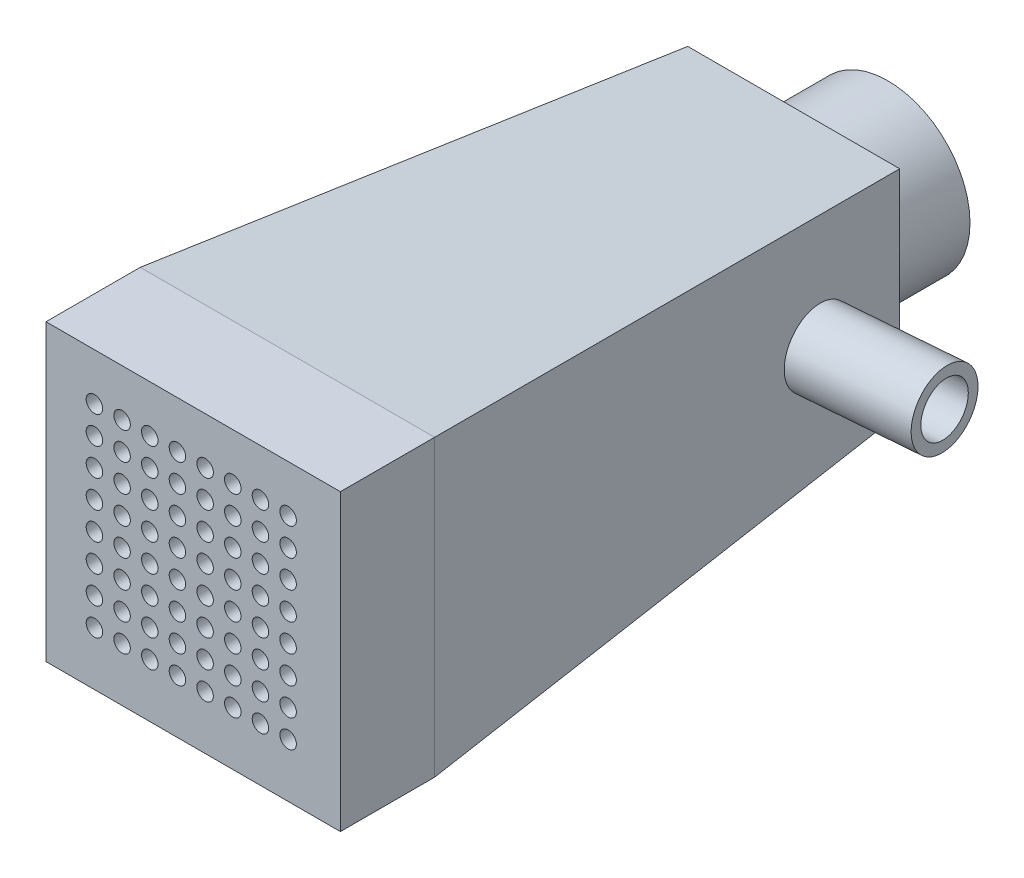
from build123d import *

# Parameters (mm, degrees)
SKETCH2_4_W         = 25
SKETCH2_4_H         = 25
BOSS_EXTRUDE2_DEPTH = 8
SKETCH5_R           = 0.7
CUT_EXTRUDE1_DEPTH  = 8
SKETCH6_R           = 3.1
SKETCH6_R_2         = 2.3
BOSS_EXTRUDE4_DEPTH = 10
CUT_EXTRUDE2_START  = -4
SKETCH6_4_R         = 2.3
CUT_EXTRUDE2_DEPTH  = 4
SKETCH9_R           = 3.1
SKETCH9_R_2         = 2.2
BOSS_EXTRUDE5_DEPTH = 10
SKETCH1_7_R         = 6.969369829
SKETCH1_7_R_2       = 4.88
BOSS_EXTRUDE7_DEPTH = 8


with BuildPart() as part:
    # Sketch1 → Loft1 section 0
    with BuildSketch(Plane.XY):
        with BuildLine():
            Line((-9, 9), (9, 9))
            Line((9, 9), (9, -9))
            Line((9, -9), (-9, -9))
            Line((-9, -9), (-9, 9))
        make_face()
    # Sketch2 → Loft1 section 1
    with BuildSketch(Plane.XY.offset(43)):
        with BuildLine():
            Line((-12.5, 12.5), (12.5, 12.5))
            Line((12.5, 12.5), (12.5, -12.5))
            Line((12.5, -12.5), (-12.5, -12.5))
            Line((-12.5, -12.5), (-12.5, 12.5))
        make_face()
    loft()

    # Cut-Loft1: read off the stored shape, not the designer's step
    # Cut-Loft1: loft between two sections, ruled curve by curve
    cut_loft1_from = [
        Edge.make_bspline([(-3.450681092, -3.450681092, 0), (-3.044014426, -3.857347759, 0), (-2.531155679, -4.22197395, 0), (-1.641760344, -4.606883572, 0), (-1.326204919, -4.708150629, 0), (-0.673711552, -4.84475124, 0), (-0.336893697, -4.88, 0), (0.336893697, -4.88, 0), (0.673711552, -4.84475124, 0), (1.326204919, -4.708150629, 0), (1.641760344, -4.606883572, 0), (2.531155679, -4.22197395, 0), (3.044014426, -3.857347759, 0), (3.450681092, -3.450681092, 0)], [0, 0, 0, 0, 0.25, 0.25, 0.375, 0.375, 0.5, 0.5, 0.625, 0.625, 0.75, 0.75, 1, 1, 1, 1], 3),
        Edge.make_bspline([(3.450681092, -3.450681092, 0), (3.857347759, -3.044014426, 0), (4.22197395, -2.531155679, 0), (4.606883572, -1.641760344, 0), (4.708150629, -1.326204919, 0), (4.84475124, -0.673711552, 0), (4.88, -0.336893697, 0), (4.88, 0.336893697, 0), (4.84475124, 0.673711552, 0), (4.708150629, 1.326204919, 0), (4.606883572, 1.641760344, 0), (4.22197395, 2.531155679, 0), (3.857347759, 3.044014426, 0), (3.450681092, 3.450681092, 0)], [0, 0, 0, 0, 0.25, 0.25, 0.375, 0.375, 0.5, 0.5, 0.625, 0.625, 0.75, 0.75, 1, 1, 1, 1], 3),
        Edge.make_bspline([(-3.450681092, 3.450681092, 0), (-3.857347759, 3.044014426, 0), (-4.22197395, 2.531155679, 0), (-4.606883572, 1.641760344, 0), (-4.708150629, 1.326204919, 0), (-4.84475124, 0.673711552, 0), (-4.88, 0.336893697, 0), (-4.88, -0.336893697, 0), (-4.84475124, -0.673711552, 0), (-4.708150629, -1.326204919, 0), (-4.606883572, -1.641760344, 0), (-4.22197395, -2.531155679, 0), (-3.857347759, -3.044014426, 0), (-3.450681092, -3.450681092, 0)], [0, 0, 0, 0, 0.25, 0.25, 0.375, 0.375, 0.5, 0.5, 0.625, 0.625, 0.75, 0.75, 1, 1, 1, 1], 3),
        Edge.make_bspline([(3.450681092, 3.450681092, 0), (3.044014426, 3.857347759, 0), (2.531155679, 4.22197395, 0), (1.641760344, 4.606883572, 0), (1.326204919, 4.708150629, 0), (0.673711552, 4.84475124, 0), (0.336893697, 4.88, 0), (-0.336893697, 4.88, 0), (-0.673711552, 4.84475124, 0), (-1.326204919, 4.708150629, 0), (-1.641760344, 4.606883572, 0), (-2.531155679, 4.22197395, 0), (-3.044014426, 3.857347759, 0), (-3.450681092, 3.450681092, 0)], [0, 0, 0, 0, 0.25, 0.25, 0.375, 0.375, 0.5, 0.5, 0.625, 0.625, 0.75, 0.75, 1, 1, 1, 1], 3),
    ]
    cut_loft1_to = [
        Edge.make_bspline([(-10, -10, 43), (-8.333333333, -10, 43), (-6.666666667, -10, 43), (-4.166666667, -10, 43), (-3.333333333, -10, 43), (-1.666666667, -10, 43), (-0.833333333, -10, 43), (0.833333333, -10, 43), (1.666666667, -10, 43), (3.333333333, -10, 43), (4.166666667, -10, 43), (6.666666667, -10, 43), (8.333333333, -10, 43), (10, -10, 43)], [0, 0, 0, 0, 0.25, 0.25, 0.375, 0.375, 0.5, 0.5, 0.625, 0.625, 0.75, 0.75, 1, 1, 1, 1], 3),
        Edge.make_bspline([(10, -10, 43), (10, -8.333333333, 43), (10, -6.666666667, 43), (10, -4.166666667, 43), (10, -3.333333333, 43), (10, -1.666666667, 43), (10, -0.833333333, 43), (10, 0.833333333, 43), (10, 1.666666667, 43), (10, 3.333333333, 43), (10, 4.166666667, 43), (10, 6.666666667, 43), (10, 8.333333333, 43), (10, 10, 43)], [0, 0, 0, 0, 0.25, 0.25, 0.375, 0.375, 0.5, 0.5, 0.625, 0.625, 0.75, 0.75, 1, 1, 1, 1], 3),
        Edge.make_bspline([(-10, 10, 43), (-10, 8.333333333, 43), (-10, 6.666666667, 43), (-10, 4.166666667, 43), (-10, 3.333333333, 43), (-10, 1.666666667, 43), (-10, 0.833333333, 43), (-10, -0.833333333, 43), (-10, -1.666666667, 43), (-10, -3.333333333, 43), (-10, -4.166666667, 43), (-10, -6.666666667, 43), (-10, -8.333333333, 43), (-10, -10, 43)], [0, 0, 0, 0, 0.25, 0.25, 0.375, 0.375, 0.5, 0.5, 0.625, 0.625, 0.75, 0.75, 1, 1, 1, 1], 3),
        Edge.make_bspline([(10, 10, 43), (8.333333333, 10, 43), (6.666666667, 10, 43), (4.166666667, 10, 43), (3.333333333, 10, 43), (1.666666667, 10, 43), (0.833333333, 10, 43), (-0.833333333, 10, 43), (-1.666666667, 10, 43), (-3.333333333, 10, 43), (-4.166666667, 10, 43), (-6.666666667, 10, 43), (-8.333333333, 10, 43), (-10, 10, 43)], [0, 0, 0, 0, 0.25, 0.25, 0.375, 0.375, 0.5, 0.5, 0.625, 0.625, 0.75, 0.75, 1, 1, 1, 1], 3),
    ]
    cut_loft1 = Solid(Shell([*[Face.make_surface_from_curves(cut_loft1_from[k], cut_loft1_to[k]) for k in range(4)], Face(Wire(cut_loft1_from)), Face(Wire(cut_loft1_to))]))
    add(cut_loft1, mode=Mode.SUBTRACT)

    # Sketch2<4> → Boss-Extrude2 (add)
    with BuildSketch(Plane.XY.offset(43)):
        Rectangle(SKETCH2_4_W, SKETCH2_4_H)
    extrude(amount=BOSS_EXTRUDE2_DEPTH)

    # Sketch5 → Cut-Extrude1 (cut)
    with BuildSketch(Plane.XY.offset(43)):
        with Locations((-8.388056057, 8.509622087)):
            Circle(SKETCH5_R)
        with Locations((-6.038056057, 8.509622087)):
            Circle(SKETCH5_R)
        with Locations((-3.688056057, 8.509622087)):
            Circle(SKETCH5_R)
        with Locations((-1.338056057, 8.509622087)):
            Circle(SKETCH5_R)
        with Locations((1.011943943, 8.509622087)):
            Circle(SKETCH5_R)
        with Locations((3.361943943, 8.509622087)):
            Circle(SKETCH5_R)
        with Locations((5.711943943, 8.509622087)):
            Circle(SKETCH5_R)
        with Locations((8.061943943, 8.509622087)):
            Circle(SKETCH5_R)
        with Locations((-6.038056057, 6.159622087)):
            Circle(SKETCH5_R)
        with Locations((-3.688056057, 6.159622087)):
            Circle(SKETCH5_R)
        with Locations((-1.338056057, 6.159622087)):
            Circle(SKETCH5_R)
        with Locations((1.011943943, 6.159622087)):
            Circle(SKETCH5_R)
        with Locations((3.361943943, 6.159622087)):
            Circle(SKETCH5_R)
        with Locations((5.711943943, 6.159622087)):
            Circle(SKETCH5_R)
        with Locations((8.061943943, 6.159622087)):
            Circle(SKETCH5_R)
        with Locations((-6.038056057, 3.809622087)):
            Circle(SKETCH5_R)
        with Locations((-3.688056057, 3.809622087)):
            Circle(SKETCH5_R)
        with Locations((-1.338056057, 3.809622087)):
            Circle(SKETCH5_R)
        with Locations((1.011943943, 3.809622087)):
            Circle(SKETCH5_R)
        with Locations((3.361943943, 3.809622087)):
            Circle(SKETCH5_R)
        with Locations((5.711943943, 3.809622087)):
            Circle(SKETCH5_R)
        with Locations((8.061943943, 3.809622087)):
            Circle(SKETCH5_R)
        with Locations((-6.038056057, 1.459622087)):
            Circle(SKETCH5_R)
        with Locations((-3.688056057, 1.459622087)):
            Circle(SKETCH5_R)
        with Locations((-1.338056057, 1.459622087)):
            Circle(SKETCH5_R)
        with Locations((1.011943943, 1.459622087)):
            Circle(SKETCH5_R)
        with Locations((3.361943943, 1.459622087)):
            Circle(SKETCH5_R)
        with Locations((5.711943943, 1.459622087)):
            Circle(SKETCH5_R)
        with Locations((8.061943943, 1.459622087)):
            Circle(SKETCH5_R)
        with Locations((-6.038056057, -0.890377913)):
            Circle(SKETCH5_R)
        with Locations((-3.688056057, -0.890377913)):
            Circle(SKETCH5_R)
        with Locations((-1.338056057, -0.890377913)):
            Circle(SKETCH5_R)
        with Locations((1.011943943, -0.890377913)):
            Circle(SKETCH5_R)
        with Locations((3.361943943, -0.890377913)):
            Circle(SKETCH5_R)
        with Locations((5.711943943, -0.890377913)):
            Circle(SKETCH5_R)
        with Locations((8.061943943, -0.890377913)):
            Circle(SKETCH5_R)
        with Locations((-6.038056057, -3.240377913)):
            Circle(SKETCH5_R)
        with Locations((-3.688056057, -3.240377913)):
            Circle(SKETCH5_R)
        with Locations((-1.338056057, -3.240377913)):
            Circle(SKETCH5_R)
        with Locations((1.011943943, -3.240377913)):
            Circle(SKETCH5_R)
        with Locations((3.361943943, -3.240377913)):
            Circle(SKETCH5_R)
        with Locations((5.711943943, -3.240377913)):
            Circle(SKETCH5_R)
        with Locations((8.061943943, -3.240377913)):
            Circle(SKETCH5_R)
        with Locations((-6.038056057, -5.590377913)):
            Circle(SKETCH5_R)
        with Locations((-3.688056057, -5.590377913)):
            Circle(SKETCH5_R)
        with Locations((-1.338056057, -5.590377913)):
            Circle(SKETCH5_R)
        with Locations((1.011943943, -5.590377913)):
            Circle(SKETCH5_R)
        with Locations((3.361943943, -5.590377913)):
            Circle(SKETCH5_R)
        with Locations((5.711943943, -5.590377913)):
            Circle(SKETCH5_R)
        with Locations((8.061943943, -5.590377913)):
            Circle(SKETCH5_R)
        with Locations((-6.038056057, -7.940377913)):
            Circle(SKETCH5_R)
        with Locations((-3.688056057, -7.940377913)):
            Circle(SKETCH5_R)
        with Locations((-1.338056057, -7.940377913)):
            Circle(SKETCH5_R)
        with Locations((1.011943943, -7.940377913)):
            Circle(SKETCH5_R)
        with Locations((3.361943943, -7.940377913)):
            Circle(SKETCH5_R)
        with Locations((5.711943943, -7.940377913)):
            Circle(SKETCH5_R)
        with Locations((8.061943943, -7.940377913)):
            Circle(SKETCH5_R)
        with Locations((-8.388056057, 6.159622087)):
            Circle(SKETCH5_R)
        with Locations((-8.388056057, 3.809622087)):
            Circle(SKETCH5_R)
        with Locations((-8.388056057, 1.459622087)):
            Circle(SKETCH5_R)
        with Locations((-8.388056057, -0.890377913)):
            Circle(SKETCH5_R)
        with Locations((-8.388056057, -3.240377913)):
            Circle(SKETCH5_R)
        with Locations((-8.388056057, -5.590377913)):
            Circle(SKETCH5_R)
        with Locations((-8.388056057, -7.940377913)):
            Circle(SKETCH5_R)
    extrude(amount=CUT_EXTRUDE1_DEPTH, mode=Mode.SUBTRACT)

    # Sketch6 → Boss-Extrude4 (add)
    with BuildSketch(Plane(origin=(-8.940765615, 0, -0.727736736), x_dir=(-0.08112705090276601, 0, 0.9967037682339824), z_dir=(-0.9967037682339824, 0, -0.08112705090276602))):
        with Locations(Location((34.477535136, -1.520969622, 0), (0, 0, 180))):
            Circle(SKETCH6_R)
        with Locations((34.477535136, -1.520969622)):
            Circle(SKETCH6_R_2, mode=Mode.SUBTRACT)
    extrude(amount=BOSS_EXTRUDE4_DEPTH)

    # Sketch6<4> → Cut-Extrude2 (cut)
    with BuildSketch(Plane(origin=(-8.940765615, 0, -0.727736736), x_dir=(-0.08112705090276601, 0, 0.9967037682339824), z_dir=(-0.9967037682339824, 0, -0.08112705090276602)).offset(CUT_EXTRUDE2_START)):
        with Locations((34.477535136, -1.520969622)):
            Circle(SKETCH6_4_R)
    extrude(amount=CUT_EXTRUDE2_DEPTH, mode=Mode.SUBTRACT)

    # Sketch9 → Boss-Extrude5 (add)
    with BuildSketch(Plane(origin=(8.940765615, 0, -0.727736736), x_dir=(-0.08112705090276603, 0, -0.9967037682339824), z_dir=(0.9967037682339824, 0, -0.08112705090276605))):
        with Locations((-8.341303969, 0)):
            Circle(SKETCH9_R)
        with Locations((-8.341303969, 0)):
            Circle(SKETCH9_R_2, mode=Mode.SUBTRACT)
    extrude(amount=BOSS_EXTRUDE5_DEPTH)

    # Sketch1<7> → Boss-Extrude7 (add)
    with BuildSketch(Plane.XY):
        Circle(SKETCH1_7_R)
        Circle(SKETCH1_7_R_2, mode=Mode.SUBTRACT)
    extrude(amount=-BOSS_EXTRUDE7_DEPTH)


solid = part.part
